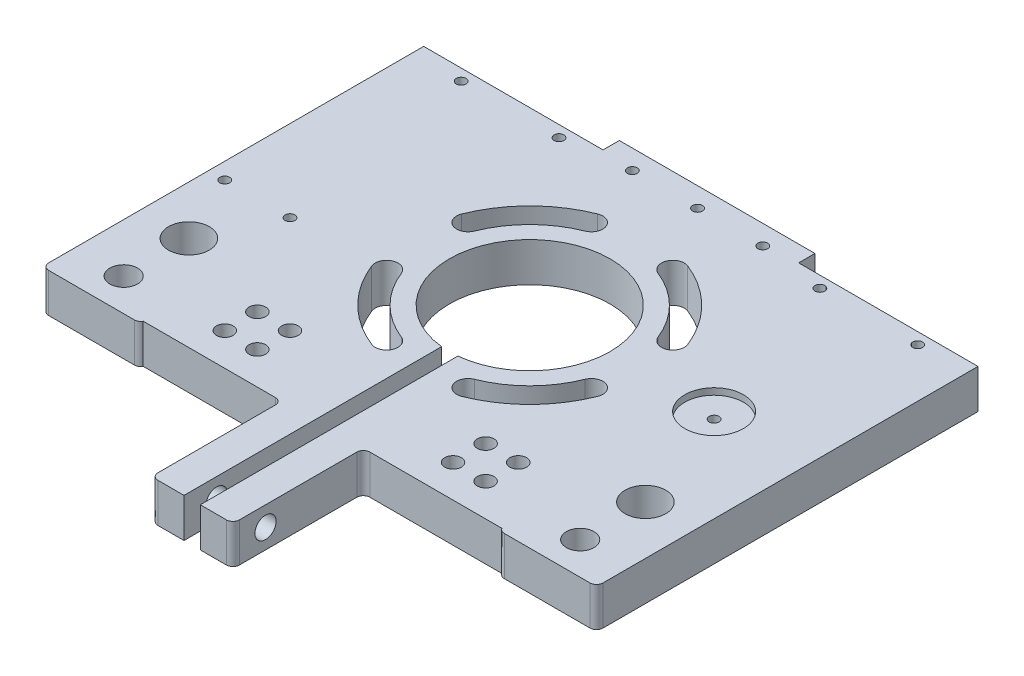
from build123d import *

# Parameters (mm, degrees)
SKETCH1_R           = 1.5
SKETCH1_R_2         = 6.25
SKETCH1_R_3         = 2.55
SKETCH1_R_4         = 4.25
BOSS_EXTRUDE1_DEPTH = 12
SKETCH2_R           = 9
CUT_EXTRUDE1_DEPTH  = 2
SKETCH3_R           = 1.5
CUT_EXTRUDE2_DEPTH  = 210.485083001
SKETCH4_R           = 3.25
CUT_EXTRUDE3_DEPTH  = 25
FILLET1_R           = 2


with BuildPart() as part:
    # Sketch1 → Boss-Extrude1 (new body)
    with BuildSketch(Plane(origin=(0, 0, 0), x_dir=(1, 0, 0), z_dir=(0, 1, 0))):
        with BuildLine():
            Line((55, 122), (55, 117))
            Line((55, 117), (0, 117))
            Line((0, 117), (0, 0))
            Line((0, 0), (30, 0))
            Line((30, 0), (30, 1))
            Line((30, 1), (72.5, 1))
            Line((72.5, 1), (72.5, -39))
            Line((72.5, -39), (82.5, -39))
            Line((82.5, -39), (82.5, 40))
            ThreePointArc((82.5, 40), (85, 89.172897463), (87.5, 40))
            Line((87.5, 40), (87.5, -39))
            Line((87.5, -39), (97.5, -39))
            Line((97.5, -39), (97.5, 1))
            Line((97.5, 1), (140, 1))
            Line((140, 1), (140, 0))
            Line((140, 0), (170, 0))
            Line((170, 0), (170, 117))
            Line((170, 117), (115, 117))
            Line((115, 117), (115, 122))
            Line((115, 122), (55, 122))
        make_face()
        with Locations(Location((65, 116, 0), (0, 0, 270))):
            Circle(SKETCH1_R, mode=Mode.SUBTRACT)
        with Locations(Location((105, 116, 0), (0, 0, 90))):
            Circle(SKETCH1_R, mode=Mode.SUBTRACT)
        with Locations(Location((45, 113.5, 0), (0, 0, 270))):
            Circle(SKETCH1_R, mode=Mode.SUBTRACT)
        with Locations(Location((15, 113.5, 0), (0, 0, 270))):
            Circle(SKETCH1_R, mode=Mode.SUBTRACT)
        with Locations(Location((155, 113.5, 0), (0, 0, 90))):
            Circle(SKETCH1_R, mode=Mode.SUBTRACT)
        with Locations(Location((125, 113.5, 0), (0, 0, 90))):
            Circle(SKETCH1_R, mode=Mode.SUBTRACT)
        with Locations(Location((15, 30, 0), (0, 0, 270))):
            Circle(SKETCH1_R_2, mode=Mode.SUBTRACT)
        with Locations(Location((155, 30, 0), (0, 0, 90))):
            Circle(SKETCH1_R_2, mode=Mode.SUBTRACT)
        with Locations(Location((5, 51, 0), (0, 0, 270))):
            Circle(SKETCH1_R, mode=Mode.SUBTRACT)
        with Locations(Location((25, 51, 0), (0, 0, 90))):
            Circle(SKETCH1_R, mode=Mode.SUBTRACT)
        with Locations(Location((45, 11, 0), (0, 0, 270))):
            Circle(SKETCH1_R_3, mode=Mode.SUBTRACT)
        with Locations(Location((55, 11, 0), (0, 0, 270))):
            Circle(SKETCH1_R_3, mode=Mode.SUBTRACT)
        with Locations(Location((45, 21, 0), (0, 0, 270))):
            Circle(SKETCH1_R_3, mode=Mode.SUBTRACT)
        with Locations(Location((55, 21, 0), (0, 0, 270))):
            Circle(SKETCH1_R_3, mode=Mode.SUBTRACT)
        with Locations(Location((125, 11, 0), (0, 0, 90))):
            Circle(SKETCH1_R_3, mode=Mode.SUBTRACT)
        with Locations(Location((125, 21, 0), (0, 0, 90))):
            Circle(SKETCH1_R_3, mode=Mode.SUBTRACT)
        with Locations(Location((115, 21, 0), (0, 0, 90))):
            Circle(SKETCH1_R_3, mode=Mode.SUBTRACT)
        with Locations(Location((115, 11, 0), (0, 0, 90))):
            Circle(SKETCH1_R_3, mode=Mode.SUBTRACT)
        with Locations(Location((155, 10, 0), (0, 0, 270))):
            Circle(SKETCH1_R_4, mode=Mode.SUBTRACT)
        with Locations(Location((15, 10, 0), (0, 0, 90))):
            Circle(SKETCH1_R_4, mode=Mode.SUBTRACT)
        with Locations(Location((85, 116, 0), (0, 0, 270))):
            Circle(SKETCH1_R, mode=Mode.SUBTRACT)
        with BuildLine():
            ThreePointArc((71.205621302, 99.178418183), (58.624917062, 90.897980402), (50.344479281, 78.317276162))
            ThreePointArc((50.344479281, 78.317276162), (52.301959095, 73.771038951), (56.848196306, 75.728518765))
            ThreePointArc((56.848196306, 75.728518765), (63.57466453, 85.948232933), (73.794378698, 92.674701158))
            ThreePointArc((73.794378698, 92.674701158), (75.751858513, 97.220938368), (71.205621302, 99.178418183))
        make_face(mode=Mode.SUBTRACT)
        with BuildLine():
            ThreePointArc((98.794378698, 99.178418183), (111.375082938, 90.897980402), (119.655520719, 78.317276162))
            ThreePointArc((119.655520719, 78.317276162), (117.698040905, 73.771038951), (113.151803694, 75.728518765))
            ThreePointArc((113.151803694, 75.728518765), (106.42533547, 85.948232933), (96.205621302, 92.674701158))
            ThreePointArc((96.205621302, 92.674701158), (94.248141487, 97.220938368), (98.794378698, 99.178418183))
        make_face(mode=Mode.SUBTRACT)
        with BuildLine():
            ThreePointArc((71.205621302, 29.867376744), (58.624917062, 38.147814525), (50.344479281, 50.728518765))
            ThreePointArc((50.344479281, 50.728518765), (52.301959095, 55.274755976), (56.848196306, 53.317276162))
            ThreePointArc((56.848196306, 53.317276162), (63.57466453, 43.097561993), (73.794378698, 36.371093769))
            ThreePointArc((73.794378698, 36.371093769), (75.751858513, 31.824856558), (71.205621302, 29.867376744))
        make_face(mode=Mode.SUBTRACT)
        with BuildLine():
            ThreePointArc((98.794378698, 29.867376744), (111.375082938, 38.147814525), (119.655520719, 50.728518765))
            ThreePointArc((119.655520719, 50.728518765), (117.698040905, 55.274755976), (113.151803694, 53.317276162))
            ThreePointArc((113.151803694, 53.317276162), (106.42533547, 43.097561993), (96.205621302, 36.371093769))
            ThreePointArc((96.205621302, 36.371093769), (94.248141487, 31.824856558), (98.794378698, 29.867376744))
        make_face(mode=Mode.SUBTRACT)
    extrude(amount=BOSS_EXTRUDE1_DEPTH)

    # Sketch2 → Cut-Extrude1 (cut)
    with BuildSketch(Plane(origin=(0, 12, 0), x_dir=(1, 0, 0), z_dir=(0, 1, 0))):
        with Locations(Location((141.55, 64.522897463, 0), (0, 0, 270))):
            Circle(SKETCH2_R)
    extrude(amount=-CUT_EXTRUDE1_DEPTH, mode=Mode.SUBTRACT)

    # Sketch3 → Cut-Extrude2 (cut, through all)
    with BuildSketch(Plane(origin=(0, 10, 0), x_dir=(1, 0, 0), z_dir=(0, 1, 0))):
        with Locations(Location((141.55, 64.522897463, 0), (0, 0, 270))):
            Circle(SKETCH3_R)
    extrude(amount=-CUT_EXTRUDE2_DEPTH, mode=Mode.SUBTRACT)

    # Sketch4 → Cut-Extrude3 (cut)
    with BuildSketch(Plane.ZY.offset(-72.5)):
        with Locations((29, 6)):
            Circle(SKETCH4_R)
    extrude(amount=-CUT_EXTRUDE3_DEPTH, mode=Mode.SUBTRACT)

    # Fillet1
    # the kernel refuses this fillet: 2 mm, written as the material it adds along each edge
    with BuildSketch(Plane(origin=(72.5, 0, -1), x_dir=(-1, 0, 0), z_dir=(0, 1, 0))) as fillet1_piece_1:
        with BuildLine():
            CenterArc((FILLET1_R, FILLET1_R), FILLET1_R, 180, 90)
            Line((0, FILLET1_R), (0, 0))
            Line((0, 0), (FILLET1_R, 0))
        make_face()
    extrude(amount=12)
    with BuildSketch(Plane(origin=(97.5, 0, -1), x_dir=(1, 0, 0), z_dir=(0, 1, 0))) as fillet1_piece_2:
        with BuildLine():
            CenterArc((FILLET1_R, -FILLET1_R), FILLET1_R, 90, 90)
            Line((0, -FILLET1_R), (0, 0))
            Line((0, 0), (FILLET1_R, 0))
        make_face()
    extrude(amount=12)
    # the kernel refuses this fillet: 2 mm, written as the material it takes off along each edge
    with BuildSketch(Plane(origin=(170, -5, 0), x_dir=(0, 0, -1), z_dir=(0, 1, 0)), Plane(origin=(97.5, -5, 39), x_dir=(0, 0, -1), z_dir=(0, 1, 0))) as fillet1_2_piece_1:
        with BuildLine():
            CenterArc((FILLET1_R, FILLET1_R), FILLET1_R, 180, 90)
            Line((0, FILLET1_R), (0, 0))
            Line((0, 0), (FILLET1_R, 0))
        make_face()
    extrude(amount=22, mode=Mode.SUBTRACT)
    with BuildSketch(Plane(origin=(140, -4.330127019, 0), x_dir=(1, 0, 0), z_dir=(0, 1, 0))) as fillet1_2_piece_2:
        with BuildLine():
            CenterArc((1.732050808, 2), FILLET1_R, 210, 60)
            Line((0, 1), (0, 0))
            Line((0, 0), (1.732050808, 0))
        make_face()
    extrude(amount=20.660254038, mode=Mode.SUBTRACT)
    with BuildSketch(Plane(origin=(72.5, -5, 39), x_dir=(0, 0, -1), z_dir=(0, 1, 0)), Plane(origin=(0, -5, 0), x_dir=(0, 0, -1), z_dir=(0, 1, 0))) as fillet1_2_piece_3:
        with BuildLine():
            CenterArc((FILLET1_R, -FILLET1_R), FILLET1_R, 90, 90)
            Line((0, -FILLET1_R), (0, 0))
            Line((0, 0), (FILLET1_R, 0))
        make_face()
    extrude(amount=22, mode=Mode.SUBTRACT)
    with BuildSketch(Plane(origin=(30, -4.330127019, 0), x_dir=(-1, 0, 0), z_dir=(0, 1, 0))) as fillet1_2_piece_4:
        with BuildLine():
            CenterArc((1.732050808, -2), FILLET1_R, 90, 60)
            Line((0, -1), (0, 0))
            Line((0, 0), (1.732050808, 0))
        make_face()
    extrude(amount=20.660254038, mode=Mode.SUBTRACT)


solid = part.part
